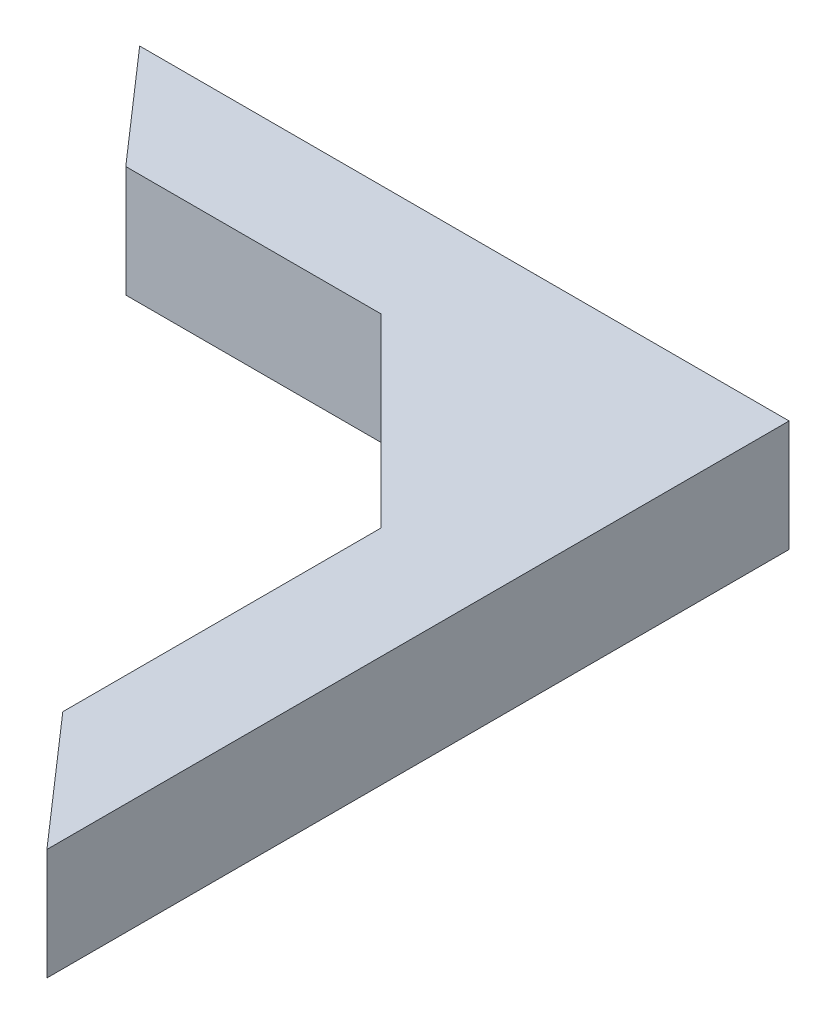
from build123d import *

# Parameters (mm, degrees)
EXTRUDE_1_DEPTH     = 6
CUT_EXTRUDE_1_DEPTH = 4.5
MOVE_START          = 3
MOVE_BODY_1_DEPTH   = 3
MOVE_BODY_1_2_DEPTH = 1.5
MOVE_START_2        = -3
MOVE_BODY_1_3_DEPTH = 3
MOVE_START_3        = 1.5
MOVE_BODY_1_4_DEPTH = 1.5


# Read off the part's stored shape, not the designer's step: 实体-移动/复制1
with BuildPart() as part:
    # 草图1 → 凸台-拉伸1 (new body)
    with BuildSketch(Plane(origin=(0, 0, 0), x_dir=(1, 0, 0), z_dir=(0, 1, 0))):
        Polygon((-35, 0), (0, 0), (0, -40), (-6, -33.142857143), (-6, -16), (-16, -6), (-29.75, -6), align=None)
    extrude(amount=EXTRUDE_1_DEPTH)

    # 草图3 → 切除-拉伸1 (cut)
    with BuildSketch(Plane(origin=(0, 6, 0), x_dir=(1, 0, 0), z_dir=(0, 1, 0))):
        Polygon((-30.592463547, -2), (-28.842463547, -4), (-15.171572875, -4), (-4, -15.171572875), (-4, -32.391386911), (-2, -34.677101196), (-2, -2), align=None)
    extrude(amount=-CUT_EXTRUDE_1_DEPTH, mode=Mode.SUBTRACT)

    # Move Body 1 outline → Move Body 1 (cut)
    with BuildSketch(Plane(origin=(0, 0, 0), x_dir=(1, 0, 0), z_dir=(0, 1, 0)).offset(MOVE_START)):
        Polygon((-35, 0), (-29.75, -6), (-16, -6), (-6, -16), (-6, -33.142857143), (0, -40), (0, 0), align=None)
        Polygon((-28.842463547, -4), (-30.592463547, -2), (-2, -2), (-2, -34.677101196), (-4, -32.391386911), (-4, -15.171572875), (-15.171572875, -4), align=None, mode=Mode.SUBTRACT)
    extrude(amount=MOVE_BODY_1_DEPTH, mode=Mode.SUBTRACT)

    # Move Body 1 2 outline → Move Body 1 2 (cut)
    with BuildSketch(Plane(origin=(0, 0, 0), x_dir=(1, 0, 0), z_dir=(0, 1, 0))):
        Polygon((-2, -2), (-30.592463547, -2), (-28.842463547, -4), (-15.171572875, -4), (-4, -15.171572875), (-4, -32.391386911), (-2, -34.677101196), align=None)
    extrude(amount=MOVE_BODY_1_2_DEPTH, mode=Mode.SUBTRACT)

    # Move Body 1 3 outline → Move Body 1 3 (add)
    with BuildSketch(Plane(origin=(0, 0, 0), x_dir=(1, 0, 0), z_dir=(0, 1, 0)).offset(MOVE_START_2)):
        Polygon((-35, 0), (-29.75, -6), (-16, -6), (-6, -16), (-6, -33.142857143), (0, -40), (0, 0), align=None)
        Polygon((-28.842463547, -4), (-30.592463547, -2), (-2, -2), (-2, -34.677101196), (-4, -32.391386911), (-4, -15.171572875), (-15.171572875, -4), align=None, mode=Mode.SUBTRACT)
    extrude(amount=MOVE_BODY_1_3_DEPTH)

    # Move Body 1 4 outline → Move Body 1 4 (add)
    with BuildSketch(Plane(origin=(0, 0, 0), x_dir=(1, 0, 0), z_dir=(0, 1, 0)).offset(MOVE_START_3)):
        Polygon((-2, -2), (-30.592463547, -2), (-28.842463547, -4), (-15.171572875, -4), (-4, -15.171572875), (-4, -32.391386911), (-2, -34.677101196), align=None)
    extrude(amount=MOVE_BODY_1_4_DEPTH)


solid = part.part
